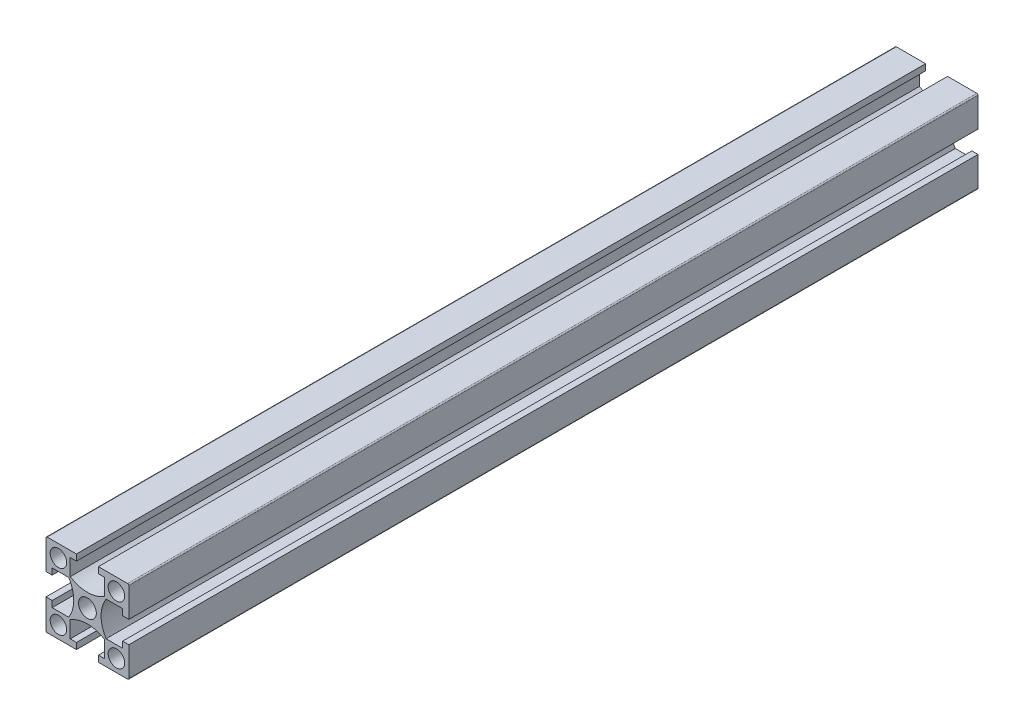
from build123d import *

# Parameters (mm, degrees)
SKETCH_1_W               = 20
SKETCH_1_H               = 20
SKETCH_1_R               = 2
SKETCH_1_R_2             = 2.15
EXTRUDE_1_DEPTH          = 205
CUT_EXTRUDE_1_REACH      = 207.487
PATTERN_CIRCULAR_1_COUNT = 4
FILLET_1_R               = 0.3
SKETCH_2_R               = 2.5
CUT_EXTRUDE_2_DEPTH      = 207.215906273


with BuildPart() as part:
    # 스케치1 → 보스-돌출1 (new body)
    with BuildSketch(Plane.XY):
        Rectangle(SKETCH_1_W, SKETCH_1_H)
        with Locations((-7, -7)):
            Circle(SKETCH_1_R, mode=Mode.SUBTRACT)
        with Locations((7, -7)):
            Circle(SKETCH_1_R, mode=Mode.SUBTRACT)
        with Locations((-7, 7)):
            Circle(SKETCH_1_R, mode=Mode.SUBTRACT)
        Circle(SKETCH_1_R_2, mode=Mode.SUBTRACT)
        with Locations((7, 7)):
            Circle(SKETCH_1_R, mode=Mode.SUBTRACT)
    extrude(amount=EXTRUDE_1_DEPTH)

    # 스케치1<3> → 컷-돌출1 (cut, up to next)
    with BuildSketch(Plane.XY, mode=Mode.PRIVATE) as cut_extrude_1_sk1:
        with BuildLine():
            Line((-8.5, 2.65), (-10, 2.65))
            Line((-10, 2.65), (-10, -2.65))
            Line((-10, -2.65), (-8.5, -2.65))
            Line((-8.5, -2.65), (-8.5, -4.15))
            Line((-8.5, -4.15), (-4.503166667, -4.15))
            ThreePointArc((-4.503166667, -4.15), (-3.3, 0), (-4.503166667, 4.15))
            Line((-4.503166667, 4.15), (-8.5, 4.15))
            Line((-8.5, 4.15), (-8.5, 2.65))
        make_face()
    cut_extrude_1_tool1 = extrude(cut_extrude_1_sk1.sketch, amount=CUT_EXTRUDE_1_REACH, mode=Mode.PRIVATE) & part.part
    cut_extrude_1 = cut_extrude_1_tool1.solids().sort_by_distance((-6.606913, 0, 0))[0]
    add(cut_extrude_1, mode=Mode.SUBTRACT)

    # 원형 패턴1: 컷-돌출1 ×4 about axis
    pattern_circular_1_axis = Axis((0, 0, 205), (0, 0, -1))
    for i in range(1, PATTERN_CIRCULAR_1_COUNT):
        add(cut_extrude_1.rotate(pattern_circular_1_axis, i * 360 / PATTERN_CIRCULAR_1_COUNT), mode=Mode.SUBTRACT)

    # 필렛1
    fillet_1_edges = [part.edges().sort_by_distance(p)[0] for p in [
        (10, -10, 102.5),
        (-10, -10, 102.5),
        (-10, 10, 102.5),
        (10, 10, 102.5),
    ]]
    fillet(fillet_1_edges, radius=FILLET_1_R)

    # 스케치2 → 컷-돌출2 (cut, through all)
    with BuildSketch(Plane(origin=(0, 10, 0), x_dir=(1, 0, 0), z_dir=(0, 1, 0))):
        with Locations((0, -194)):
            Circle(SKETCH_2_R)
        with Locations((0, -31)):
            Circle(SKETCH_2_R)
    extrude(amount=-CUT_EXTRUDE_2_DEPTH, mode=Mode.SUBTRACT)


solid = part.part
